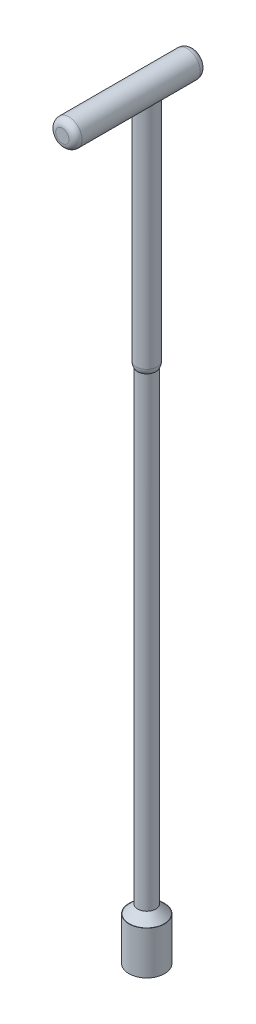
from build123d import *

# Parameters (mm, degrees)
SKETCH1_R                = 19
BOSS_EXTRUDE1_DEPTH      = 46
SKETCH2_R                = 9.65
BOSS_EXTRUDE2_DEPTH      = 505
SKETCH3_R                = 11.15
BOSS_EXTRUDE3_DEPTH      = 250
CHAMFER1_SIZE            = 9
FILLET1_R                = 10
BOSS_EXTRUDE4_DEPTH      = 90
BOSS_EXTRUDE4_DEPTH_BACK = 50
SKETCH4_R                = 14.05
FILLET2_R                = 7


with BuildPart() as part:
    # Sketch1 → Boss-Extrude1 (new body)
    with BuildSketch(Plane(origin=(0, 0, 0), x_dir=(1, 0, 0), z_dir=(0, 1, 0))):
        with Locations(Location((0, 0, 0), (0, 0, 270))):
            Circle(SKETCH1_R)
    extrude(amount=BOSS_EXTRUDE1_DEPTH)

    # Sketch2 → Boss-Extrude2 (add)
    with BuildSketch(Plane(origin=(0, 46, 0), x_dir=(1, 0, 0), z_dir=(0, 1, 0))):
        with Locations(Location((0, 0, 0), (0, 0, 270))):
            Circle(SKETCH2_R)
    extrude(amount=BOSS_EXTRUDE2_DEPTH)

    # Sketch3 → Boss-Extrude3 (add)
    with BuildSketch(Plane(origin=(0, 551, 0), x_dir=(1, 0, 0), z_dir=(0, 1, 0))):
        with Locations(Location((0, 0, 0), (0, 0, 270))):
            Circle(SKETCH3_R)
    extrude(amount=BOSS_EXTRUDE3_DEPTH)

    # Chamfer1
    chamfer1_edges = [part.edges().sort_by_distance(p)[0] for p in [
        (0, 46, -9.65),
    ]]
    chamfer(chamfer1_edges, length=CHAMFER1_SIZE)

    # Fillet1
    # the kernel refuses this fillet: 10 mm, written as the material it takes off along each edge
    with BuildSketch(Plane(origin=(0, 551, 0), x_dir=(0, 0, 1), z_dir=(-1, 0, 0))) as fillet1_piece_1:
        with BuildLine():
            CenterArc((1.15, 5.267826876), FILLET1_R, 328.211669383, 31.788330617)
            Line((11.15, 5.267826876), (11.35, 5.267826876))
            Line((11.35, 5.267826876), (11.35, 0))
            Line((11.35, 0), (11.15, -0.2))
            ThreePointArc((11.15, -0.2), (10.4, -0.2), (9.82, -0.105356538))
            Line((9.82, -0.105356538), (9.65, 0))
        make_face()
    revolve(axis=Axis((0, 551, 0), (0, 1, 0)), mode=Mode.SUBTRACT)

    # Sketch4 → Boss-Extrude4 (add, two sides: drawn at the far end of the back side and taken through both)
    with BuildSketch(Plane.XY.offset(-BOSS_EXTRUDE4_DEPTH_BACK)):
        with Locations((0, 809)):
            Circle(SKETCH4_R)
    extrude(amount=BOSS_EXTRUDE4_DEPTH + BOSS_EXTRUDE4_DEPTH_BACK)

    # Fillet2
    fillet2_edges = [part.edges().sort_by_distance(p)[0] for p in [
        (-14.05, 809, -50),
        (-14.05, 809, 90),
    ]]
    fillet(fillet2_edges, radius=FILLET2_R)


solid = part.part
